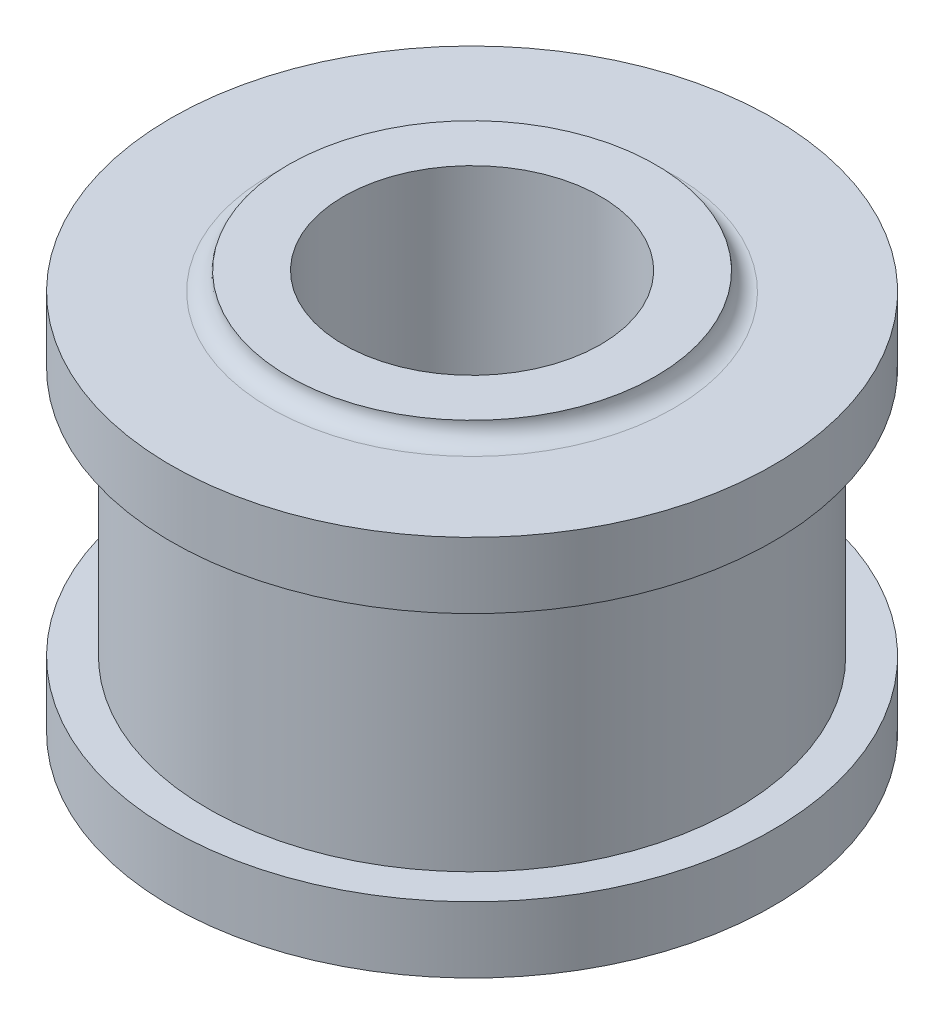
from build123d import *

# Parameters (mm, degrees)
CUT_EXTRUDE1_REACH = 83.308
SKETCH2_R          = 17.5
FILLET1_R          = 2.5


with BuildPart() as part:
    # Sketch1 → Revolve1 (revolve)
    with BuildSketch(Plane.XY, mode=Mode.PRIVATE) as revolve1_sk:
        Polygon((0, 0), (25, 0), (25, 2.5), (41, 2.5), (41, 11.5), (36, 11.5), (36, 45.5), (41, 45.5), (41, 54.5), (25, 54.5), (25, 57), (0, 57), align=None)
    revolve(revolve1_sk.sketch.rotate(Axis((0, 60.737704918, 0), (0, -1, 0)), 180), axis=Axis((0, 60.737704918, 0), (0, -1, 0)))

    # Sketch2 → Cut-Extrude1 (cut, up to next)
    with BuildSketch(Plane(origin=(0, 57, 0), x_dir=(1, 0, 0), z_dir=(0, 1, 0)), mode=Mode.PRIVATE) as cut_extrude1_sk1:
        with Locations(Location((0, 0, 0), (0, 0, 180))):
            Circle(SKETCH2_R)
    cut_extrude1_tool1 = extrude(cut_extrude1_sk1.sketch, amount=-CUT_EXTRUDE1_REACH, mode=Mode.PRIVATE) & part.part
    add(cut_extrude1_tool1.solids().sort_by_distance((0, 57, 0))[0], mode=Mode.SUBTRACT)

    # Fillet1
    fillet1_edges = [part.edges().sort_by_distance(p)[0] for p in [
        (25, 54.5, 0),
        (25, 2.5, 0),
    ]]
    fillet(fillet1_edges, radius=FILLET1_R - 0.0001)  # a hair under: the kernel refuses the full size


solid = part.part
